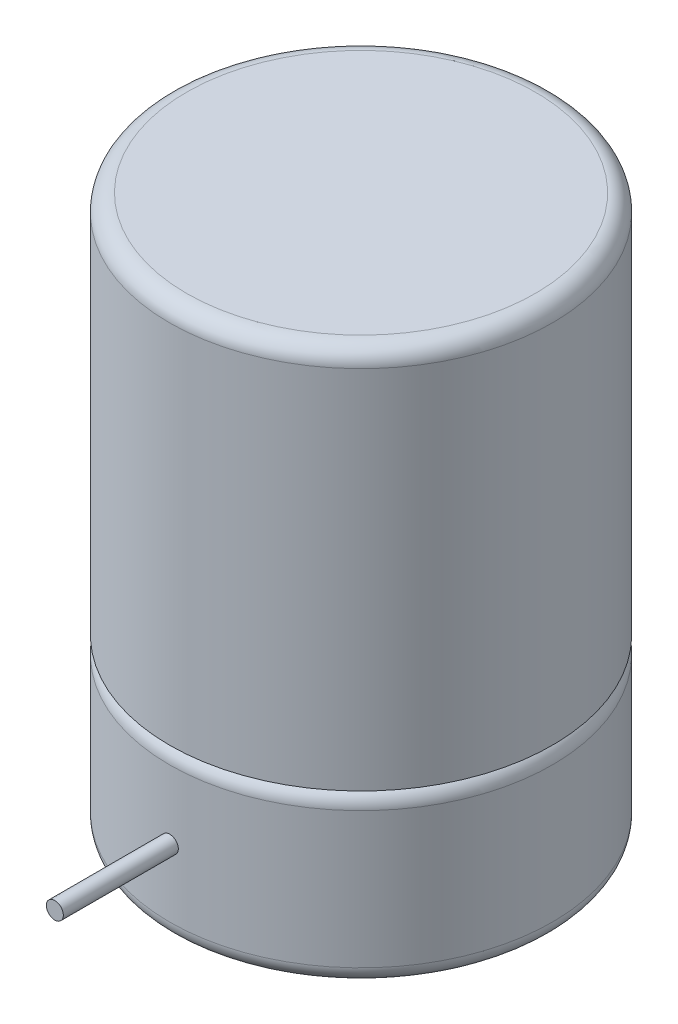
from build123d import *

# Parameters (mm, degrees)
SKETCH1_R           = 14.2875
BOSS_EXTRUDE1_DEPTH = 12.7
FILLET1_R           = 1.27
SKETCH3_R           = 14.2875
BOSS_EXTRUDE2_DEPTH = 28.575
FILLET2_R           = 1.27
SKETCH4_R           = 0.635
BOSS_EXTRUDE3_DEPTH = 22.86


with BuildPart() as part:
    # Sketch1 → Boss-Extrude1 (new body)
    with BuildSketch(Plane(origin=(0, 0, 0), x_dir=(1, 0, 0), z_dir=(0, 1, 0))):
        Circle(SKETCH1_R)
    extrude(amount=BOSS_EXTRUDE1_DEPTH)

    # Fillet1
    fillet1_edges = [part.edges().sort_by_distance(p)[0] for p in [
        (-14.2875, 0, 0),
        (-14.2875, 12.7, 0),
    ]]
    fillet(fillet1_edges, radius=FILLET1_R)

    # Sketch3 → Boss-Extrude2 (add)
    with BuildSketch(Plane(origin=(0, 12.7, 0), x_dir=(1, 0, 0), z_dir=(0, 1, 0))):
        Circle(SKETCH3_R)
    extrude(amount=BOSS_EXTRUDE2_DEPTH)

    # Fillet2
    fillet2_edges = [part.edges().sort_by_distance(p)[0] for p in [
        (-14.2875, 41.275, 0),
    ]]
    fillet(fillet2_edges, radius=FILLET2_R)

    # Sketch4 → Boss-Extrude3 (add)
    with BuildSketch(Plane.XY):
        with Locations((0, 6.31891406)):
            Circle(SKETCH4_R)
    extrude(amount=BOSS_EXTRUDE3_DEPTH)


solid = part.part
